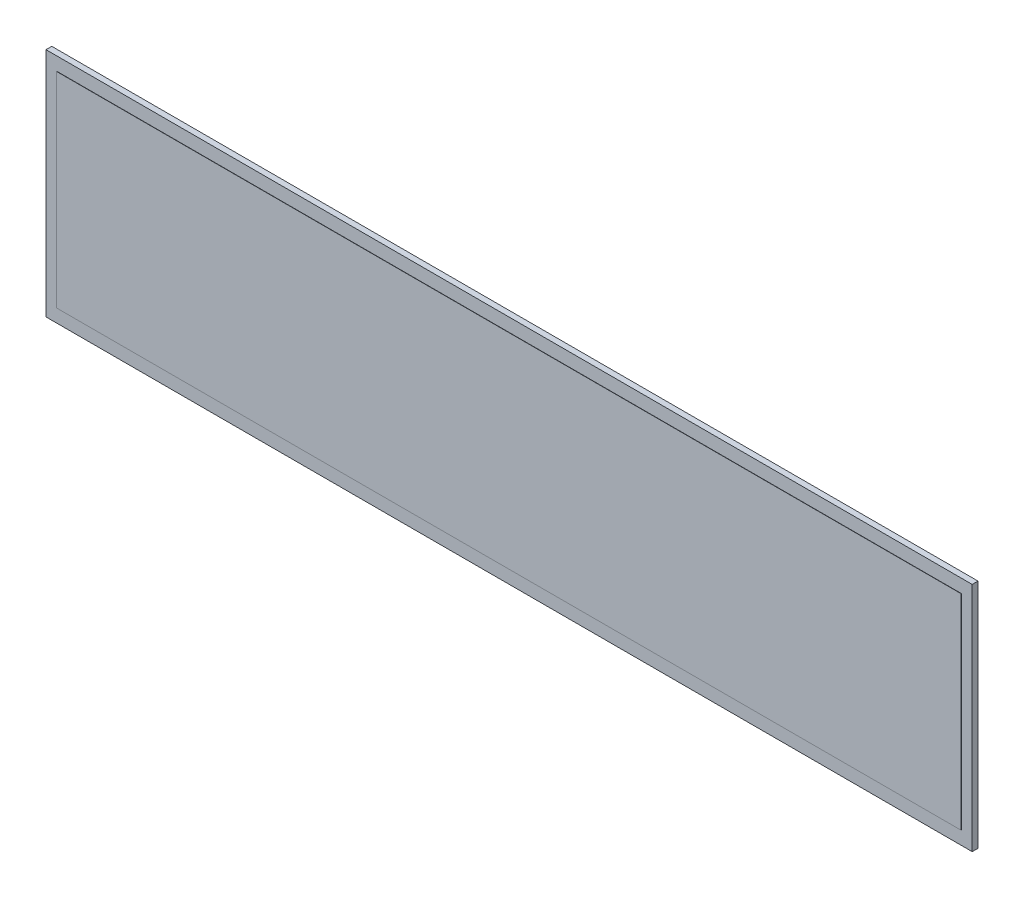
from build123d import *

# Parameters (mm, degrees)
SKETCH1_W           = 689.102
SKETCH1_H           = 172.212
BOSS_EXTRUDE1_DEPTH = 2.159
SKETCH2_W           = 673.1
SKETCH2_H           = 152.4
BOSS_EXTRUDE2_DEPTH = 0.2032


with BuildPart() as part:
    # Sketch1 → Boss-Extrude1 (new, symmetric)
    with BuildSketch(Plane.XY):
        Rectangle(SKETCH1_W, SKETCH1_H)
    extrude(amount=BOSS_EXTRUDE1_DEPTH, both=True)

    # Sketch2 → Boss-Extrude2 (add)
    with BuildSketch(Plane.XY.offset(2.159)):
        Rectangle(SKETCH2_W, SKETCH2_H)
    extrude(amount=BOSS_EXTRUDE2_DEPTH)


solid = part.part
